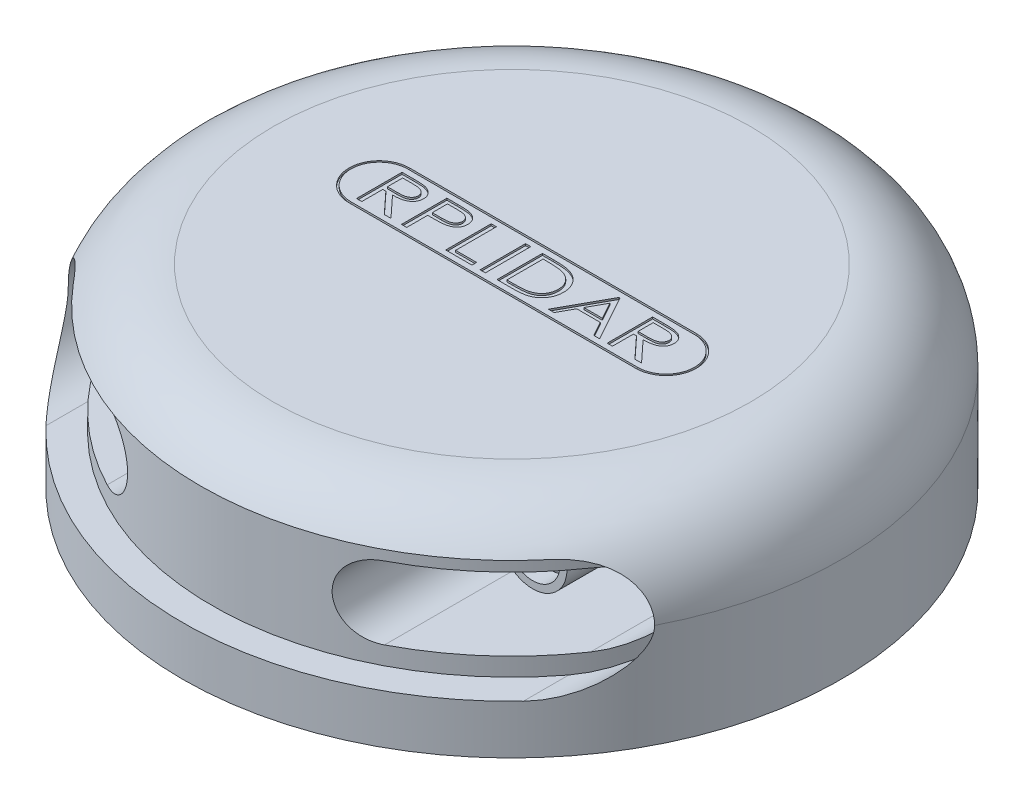
from build123d import *

# Parameters (mm, degrees)
IZIM1_R                     = 36.25
Y_KSEKLIK_EKSTR_ZYON1_DEPTH = 21.4
RADYUS1_R                   = 10
KES_EKSTR_ZYON1_DEPTH       = 41.4
IZIM3_R                     = 33.003248149
Y_KSEKLIK_EKSTR_ZYON2_DEPTH = 12.4
KES_EKSTR_ZYON2_DEPTH       = 44.4
IZIM5_R                     = 3.775
IZIM5_R_2                   = 3
IZIM5_R_3                   = 1.5
Y_KSEKLIK_EKSTR_ZYON4_DEPTH = 16
IZIM6_R                     = 35
KES_EKSTR_ZYON3_DEPTH       = 5
Y_KSEKLIK_EKSTR_ZYON5_START = -3
IZIM8_R                     = 1.5
IZIM8_R_2                   = 3
Y_KSEKLIK_EKSTR_ZYON5_DEPTH = 1
IZIM9_W                     = 0.576923077
IZIM9_H                     = 5
KES_EKSTR_ZYON4_DEPTH       = 0.2
KES_EKSTR_ZYON5_DEPTH       = 0.2


with BuildPart() as part:
    # Çizim1 → Yükseklik-Ekstrüzyon1 (new body)
    with BuildSketch(Plane(origin=(0, 0, 0), x_dir=(1, 0, 0), z_dir=(0, 1, 0))):
        Circle(IZIM1_R)
    extrude(amount=Y_KSEKLIK_EKSTR_ZYON1_DEPTH)

    # Radyus1
    radyus1_edges = [part.edges().sort_by_distance(p)[0] for p in [
        (-36.25, 21.4, 0),
    ]]
    fillet(radyus1_edges, radius=RADYUS1_R)

    # Çizim2 → Kes-Ekstrüzyon1 (cut)
    with BuildSketch(Plane.XY):
        with BuildLine():
            Line((-26.25, 17.4), (26.25, 17.4))
            ThreePointArc((26.25, 17.4), (32.25, 11.4), (26.25, 5.4))
            Line((26.25, 5.4), (-26.25, 5.4))
            ThreePointArc((-26.25, 5.4), (-32.25, 11.4), (-26.25, 17.4))
        make_face()
    extrude(amount=KES_EKSTR_ZYON1_DEPTH, mode=Mode.SUBTRACT)

    # Çizim3 → Yükseklik-Ekstrüzyon2 (add)
    with BuildSketch(Plane(origin=(0, 5.4, 0), x_dir=(1, 0, 0), z_dir=(0, 1, 0))):
        Circle(IZIM3_R)
    extrude(amount=Y_KSEKLIK_EKSTR_ZYON2_DEPTH)

    # Çizim4 → Kes-Ekstrüzyon2 (cut)
    with BuildSketch(Plane.XY):
        with BuildLine():
            Line((-27.25, 15.4), (-15.25, 15.4))
            ThreePointArc((-15.25, 15.4), (-11.25, 11.4), (-15.25, 7.4))
            Line((-15.25, 7.4), (-27.25, 7.4))
            ThreePointArc((-27.25, 7.4), (-31.25, 11.4), (-27.25, 15.4))
        make_face()
        with BuildLine():
            Line((27.25, 15.4), (15.25, 15.4))
            ThreePointArc((15.25, 15.4), (11.25, 11.4), (15.25, 7.4))
            Line((15.25, 7.4), (27.25, 7.4))
            ThreePointArc((27.25, 7.4), (31.25, 11.4), (27.25, 15.4))
        make_face()
    extrude(amount=KES_EKSTR_ZYON2_DEPTH, mode=Mode.SUBTRACT)

    # Çizim5 → Yükseklik-Ekstrüzyon4 (add)
    # profile 1 of 2: a face of its own
    with BuildSketch(Plane.XY):
        with Locations((18.281419494, 11.4)):
            Circle(IZIM5_R)
        with Locations((18.281419494, 11.4)):
            Circle(IZIM5_R_2, mode=Mode.SUBTRACT)
    # profile 2 of 2: a face of its own
    with BuildSketch(Plane.XY):
        with Locations((-26.25, 11.4)):
            Circle(IZIM5_R_2)
        with Locations((-26.25, 11.4)):
            Circle(IZIM5_R_3, mode=Mode.SUBTRACT)
    extrude(amount=Y_KSEKLIK_EKSTR_ZYON4_DEPTH)

    # Çizim6 → Kes-Ekstrüzyon3 (cut)
    with BuildSketch(Plane.XZ):
        Circle(IZIM6_R)
    extrude(amount=-KES_EKSTR_ZYON3_DEPTH, mode=Mode.SUBTRACT)

    # Çizim8 → Yükseklik-Ekstrüzyon5 (add)
    with BuildSketch(Plane.XY.offset(16).offset(Y_KSEKLIK_EKSTR_ZYON5_START)):
        with Locations((-26.25, 11.4)):
            Circle(IZIM8_R)
        with Locations((18.281419494, 11.4)):
            Circle(IZIM8_R_2)
    extrude(amount=Y_KSEKLIK_EKSTR_ZYON5_DEPTH)

    # Çizim9 → Kes-Ekstrüzyon4 (cut)
    # profile 1 of 7: a face of its own
    with BuildSketch(Plane(origin=(0, 21.4, 0), x_dir=(1, 0, 0), z_dir=(0, 1, 0))):
        with BuildLine():
            Line((-14.811265296, 2.721015451), (-13.627371066, 2.721015451))
            add(Edge.make_bspline(
                [(-13.627371066, 2.721015451), (-13.548244875, 2.720793192), (-13.396329701, 2.720366473), (-13.178606522, 2.717986165), (-12.98065628, 2.71115411), (-12.802931058, 2.705348264), (-12.645070101, 2.694505553), (-12.507339404, 2.684541481), (-12.389357514, 2.670789975), (-12.317901466, 2.658518426), (-12.28522363, 2.652906477)],
                knots=[0, 0, 0, 0, 1.411630423, 2.710203546, 3.884117758, 4.945139696, 5.88215703, 6.706718827, 7.408564682, 8, 8, 8, 8], degree=3))
            add(Edge.make_bspline(
                [(-12.28522363, 2.652906477), (-12.241996213, 2.643872149), (-12.156775558, 2.626061432), (-12.033721455, 2.58862483), (-11.916749262, 2.544151294), (-11.805359797, 2.493741591), (-11.700921588, 2.434021444), (-11.602452081, 2.367805983), (-11.509613042, 2.29454005), (-11.424454449, 2.213570862), (-11.345348993, 2.128176641), (-11.278753025, 2.035341371), (-11.220672698, 1.938996717), (-11.174658622, 1.836946947), (-11.138537841, 1.730578976), (-11.112429197, 1.61925413), (-11.095858609, 1.503233296), (-11.09417105, 1.423996485), (-11.093316579, 1.383876028)],
                knots=[0, 0, 0, 0, 1.11641643, 2.200958269, 3.248516537, 4.279957034, 5.289565817, 6.287204707, 7.27885839, 8.276390078, 9.256727559, 10.217710867, 11.160418021, 12.097511966, 13.042749274, 13.99714418, 14.985881811, 16, 16, 16, 16], degree=3))
            add(Edge.make_bspline(
                [(-11.093316579, 1.383876028), (-11.094253954, 1.350137311), (-11.096104869, 1.283517801), (-11.105764691, 1.184938783), (-11.124030569, 1.089893071), (-11.149031153, 0.997619642), (-11.182319144, 0.909146956), (-11.221524408, 0.822778024), (-11.268558565, 0.740078552), (-11.322707917, 0.660565209), (-11.384212868, 0.585994143), (-11.450083531, 0.513978726), (-11.523642305, 0.448211646), (-11.603000324, 0.386459268), (-11.689506833, 0.331172266), (-11.780867316, 0.27819848), (-11.879220625, 0.231612026), (-11.984085156, 0.189009526), (-12.097345013, 0.15219902), (-12.219458111, 0.118639919), (-12.352204202, 0.09256061), (-12.494755415, 0.069109005), (-12.647858216, 0.051490036), (-12.811222324, 0.038627473), (-12.984595694, 0.030532923), (-13.103523951, 0.029327249), (-13.164630681, 0.028707759)],
                knots=[0, 0, 0, 0, 0.870437867, 1.718741786, 2.551384448, 3.36406043, 4.181467661, 4.986810527, 5.808199835, 6.632248171, 7.464757229, 8.299534648, 9.147007689, 10.006514551, 10.890268779, 11.792828836, 12.72878645, 13.694651385, 14.710400546, 15.798752409, 16.958998952, 18.197760763, 19.524398659, 20.932521486, 22.423893651, 24, 24, 24, 24], degree=3))
            Line((-13.164630681, 0.028707759), (-11.029214014, -2.278984549))
            Line((-11.029214014, -2.278984549), (-11.760383886, -2.278984549))
            Line((-11.760383886, -2.278984549), (-13.895800553, 0.028707759))
            Line((-13.895800553, 0.028707759), (-14.23434222, 0.028707759))
            Line((-14.23434222, 0.028707759), (-14.23434222, -2.278984549))
            Line((-14.23434222, -2.278984549), (-14.811265296, -2.278984549))
            Line((-14.811265296, -2.278984549), (-14.811265296, 2.721015451))
        make_face()
        with BuildLine():
            Line((-14.23434222, 2.208194939), (-14.23434222, 0.541528272))
            Line((-14.23434222, 0.541528272), (-13.18766754, 0.534517054))
            add(Edge.make_bspline(
                [(-13.18766754, 0.534517054), (-13.138582028, 0.534493598), (-13.043720757, 0.534448269), (-12.906502217, 0.540178745), (-12.779219242, 0.546624385), (-12.661954234, 0.55656408), (-12.554368116, 0.569522205), (-12.456697785, 0.585113687), (-12.368746987, 0.604171374), (-12.266340722, 0.632784269), (-12.151725427, 0.677602554), (-12.028064547, 0.745040332), (-11.921230397, 0.827527788), (-11.83125886, 0.923244124), (-11.760411168, 1.029154245), (-11.708128362, 1.142178355), (-11.675668274, 1.261552905), (-11.672056072, 1.343613151), (-11.670239655, 1.384877631)],
                knots=[0, 0, 0, 0, 1.205111977, 2.328965291, 3.371672642, 4.334318186, 5.217938529, 6.031964904, 6.761988022, 7.426368084, 8.641199984, 9.775054944, 10.873689325, 11.940859355, 12.986752222, 13.988165942, 14.988337359, 16, 16, 16, 16], degree=3))
            add(Edge.make_bspline(
                [(-11.670239655, 1.384877631), (-11.672061171, 1.425144916), (-11.675684373, 1.505241102), (-11.708222568, 1.622094703), (-11.761218658, 1.732611018), (-11.834010449, 1.835456758), (-11.922208389, 1.92921002), (-12.025971677, 2.009043138), (-12.142215312, 2.074614719), (-12.250002005, 2.116675962), (-12.346166948, 2.142423118), (-12.429966093, 2.160738445), (-12.524988755, 2.175339931), (-12.631304277, 2.186907307), (-12.748494257, 2.197137586), (-12.877102634, 2.2038767), (-13.016700672, 2.207891247), (-13.113545998, 2.20809142), (-13.163629079, 2.208194939)],
                knots=[0, 0, 0, 0, 1.007089001, 2.003213978, 3.013250479, 4.064283037, 5.146917847, 6.225928548, 7.33072321, 8.480016439, 9.113044939, 9.823344944, 10.627712821, 11.519897955, 12.501985578, 13.574102818, 14.745459281, 16, 16, 16, 16], degree=3))
            Line((-13.163629079, 2.208194939), (-14.23434222, 2.208194939))
        make_face(mode=Mode.SUBTRACT)
    # profile 2 of 7: a face of its own
    with BuildSketch(Plane(origin=(0, 21.4, 0), x_dir=(1, 0, 0), z_dir=(0, 1, 0))):
        with BuildLine():
            Line((-9.875367861, 2.721015451), (-8.710504079, 2.721015451))
            add(Edge.make_bspline(
                [(-8.710504079, 2.721015451), (-8.630373341, 2.720944651), (-8.477111744, 2.720809235), (-8.257084981, 2.71646929), (-8.057404582, 2.710767878), (-7.878103358, 2.702738282), (-7.719387761, 2.693416449), (-7.58118934, 2.680043295), (-7.462638198, 2.666340363), (-7.390996871, 2.652296755), (-7.358340617, 2.645895259)],
                knots=[0, 0, 0, 0, 1.418218073, 2.712546675, 3.894916518, 4.953717513, 5.889237769, 6.708316399, 7.411212084, 8, 8, 8, 8], degree=3))
            add(Edge.make_bspline(
                [(-7.358340617, 2.645895259), (-7.317467191, 2.63642007), (-7.236671409, 2.617690168), (-7.119783408, 2.580660765), (-7.008739277, 2.536245678), (-6.903326918, 2.485000114), (-6.803104977, 2.427412641), (-6.709446988, 2.361436243), (-6.621028906, 2.289515411), (-6.539189492, 2.210256199), (-6.463834725, 2.126181798), (-6.399267635, 2.034792119), (-6.344417234, 1.938827962), (-6.298035303, 1.837655211), (-6.265146659, 1.730271094), (-6.239461276, 1.618239024), (-6.224319993, 1.500809334), (-6.222465144, 1.420644225), (-6.221521707, 1.379869618)],
                knots=[0, 0, 0, 0, 1.086341783, 2.147405818, 3.171829542, 4.181180362, 5.180780209, 6.161883427, 7.145042111, 8.129606692, 9.109794985, 10.064714252, 11.021393595, 11.969594772, 12.940393889, 13.924236774, 14.944198669, 16, 16, 16, 16], degree=3))
            add(Edge.make_bspline(
                [(-6.221521707, 1.379869618), (-6.222555538, 1.33877025), (-6.224578967, 1.258329966), (-6.23834793, 1.140147652), (-6.263672674, 1.027954997), (-6.298011871, 0.921112212), (-6.340494488, 0.819051891), (-6.395686701, 0.723873777), (-6.45849134, 0.632979138), (-6.532189425, 0.549188709), (-6.613551698, 0.470727733), (-6.702713253, 0.398693494), (-6.799247152, 0.333432876), (-6.902784351, 0.275200237), (-7.013805822, 0.224088511), (-7.131866056, 0.179073261), (-7.25777106, 0.14082902), (-7.34485006, 0.1209878), (-7.389390296, 0.110839169)],
                knots=[0, 0, 0, 0, 1.045861245, 2.046974867, 3.021934933, 3.967695345, 4.900313686, 5.828704379, 6.76205769, 7.707550943, 8.662917084, 9.635505162, 10.620482456, 11.624763484, 12.654874111, 13.727818363, 14.837796611, 16, 16, 16, 16], degree=3))
            add(Edge.make_bspline(
                [(-7.389390296, 0.110839169), (-7.426065523, 0.104178914), (-7.506467019, 0.089577929), (-7.638854405, 0.073203927), (-7.792859861, 0.059439127), (-7.968572354, 0.048892306), (-8.165578264, 0.040022689), (-8.384271358, 0.03291367), (-8.624685576, 0.029015419), (-8.792300248, 0.028813261), (-8.879774912, 0.028707759)],
                knots=[0, 0, 0, 0, 0.59852503, 1.312120248, 2.141233431, 3.081389991, 4.138754772, 5.308216838, 6.595213503, 8, 8, 8, 8], degree=3))
            Line((-8.879774912, 0.028707759), (-9.298444784, 0.028707759))
            Line((-9.298444784, 0.028707759), (-9.298444784, -2.278984549))
            Line((-9.298444784, -2.278984549), (-9.875367861, -2.278984549))
            Line((-9.875367861, -2.278984549), (-9.875367861, 2.721015451))
        make_face()
        with BuildLine():
            Line((-9.298444784, 2.208194939), (-9.298444784, 0.541528272))
            Line((-9.298444784, 0.541528272), (-8.294839014, 0.530510644))
            add(Edge.make_bspline(
                [(-8.294839014, 0.530510644), (-8.245753842, 0.530490802), (-8.150893228, 0.530452456), (-8.014003258, 0.536120633), (-7.887068356, 0.542708672), (-7.770432682, 0.552369886), (-7.663986092, 0.565852997), (-7.567729817, 0.579684345), (-7.482103629, 0.599529064), (-7.38228731, 0.626032292), (-7.271042541, 0.671364544), (-7.15018903, 0.737642454), (-7.046293112, 0.821251878), (-6.957257664, 0.916157611), (-6.887843897, 1.022478631), (-6.834970449, 1.134965325), (-6.804201874, 1.254717469), (-6.800372415, 1.336632772), (-6.798444784, 1.377866413)],
                knots=[0, 0, 0, 0, 1.216884587, 2.351716704, 3.39634486, 4.368394386, 5.252429777, 6.056753736, 6.777742383, 7.430440621, 8.615602712, 9.746078915, 10.835909208, 11.907861826, 12.959387667, 13.97058409, 14.978454535, 16, 16, 16, 16], degree=3))
            add(Edge.make_bspline(
                [(-6.798444784, 1.377866413), (-6.800384708, 1.418104674), (-6.804254901, 1.498380894), (-6.835209414, 1.616044246), (-6.887762241, 1.7273631), (-6.957665091, 1.832272653), (-7.044323664, 1.927108069), (-7.145903659, 2.007591951), (-7.259210215, 2.075112938), (-7.365266435, 2.116342009), (-7.459613466, 2.142639331), (-7.541517651, 2.160498428), (-7.633815707, 2.175332282), (-7.736467129, 2.186923735), (-7.849650023, 2.197153511), (-7.973589733, 2.203833335), (-8.10817862, 2.207912639), (-8.201352831, 2.20809841), (-8.249766899, 2.208194939)],
                knots=[0, 0, 0, 0, 1.024572037, 2.044043851, 3.075692791, 4.149430532, 5.245489805, 6.335123243, 7.441242237, 8.594652972, 9.222274541, 9.936592297, 10.729720506, 11.603583922, 12.568814115, 13.625561263, 14.766222551, 16, 16, 16, 16], degree=3))
            Line((-8.249766899, 2.208194939), (-9.298444784, 2.208194939))
        make_face(mode=Mode.SUBTRACT)
    # profile 3 of 7: a face of its own
    with BuildSketch(Plane(origin=(0, 21.4, 0), x_dir=(1, 0, 0), z_dir=(0, 1, 0))):
        Polygon((-5.003572989, 2.721015451), (-4.426649912, 2.721015451), (-4.426649912, -1.766164036), (-2.118957604, -1.766164036), (-2.118957604, -2.278984549), (-5.003572989, -2.278984549), align=None)
    # profile 4 of 7: a face of its own
    with BuildSketch(Plane(origin=(0, 21.4, 0), x_dir=(1, 0, 0), z_dir=(0, 1, 0))):
        with Locations((-0.933060169, 0.221015451)):
            Rectangle(IZIM9_W, IZIM9_H)
    # profile 5 of 7: a face of its own
    with BuildSketch(Plane(origin=(0, 21.4, 0), x_dir=(1, 0, 0), z_dir=(0, 1, 0))):
        with BuildLine():
            Line((0.637452652, -2.278984549), (0.637452652, 2.721015451))
            Line((0.637452652, 2.721015451), (1.836370921, 2.721015451))
            add(Edge.make_bspline(
                [(1.836370921, 2.721015451), (1.940876345, 2.720385326), (2.142574008, 2.71916917), (2.433791334, 2.711417467), (2.702677108, 2.697772828), (2.949134513, 2.677650709), (3.173764741, 2.653365656), (3.376299007, 2.622480678), (3.55677558, 2.586624198), (3.668125665, 2.555387321), (3.720385345, 2.54072699)],
                knots=[0, 0, 0, 0, 1.3211948, 2.549933714, 3.682670825, 4.72443222, 5.675778669, 6.538377397, 7.314020028, 8, 8, 8, 8], degree=3))
            add(Edge.make_bspline(
                [(3.720385345, 2.54072699), (3.78885106, 2.518690038), (3.923860706, 2.475234695), (4.117410141, 2.393701941), (4.299204236, 2.300062234), (4.470798611, 2.196092887), (4.629410964, 2.078397957), (4.778390443, 1.951125329), (4.913262875, 1.809885192), (5.037791693, 1.658991543), (5.148542887, 1.498054522), (5.245546558, 1.329083951), (5.326280122, 1.152059169), (5.394413268, 0.968294594), (5.444930292, 0.775878733), (5.481642154, 0.576344097), (5.505906331, 0.369514002), (5.508123535, 0.229097311), (5.509247524, 0.15791449)],
                knots=[0, 0, 0, 0, 1.07436122, 2.118565874, 3.133765883, 4.127984174, 5.11282082, 6.081965103, 7.052225859, 8.026990791, 9.002585186, 9.967895436, 10.934455346, 11.906676447, 12.892927292, 13.902719417, 14.936804816, 16, 16, 16, 16], degree=3))
            add(Edge.make_bspline(
                [(5.509247524, 0.15791449), (5.50800468, 0.096116611), (5.505554524, -0.025712383), (5.488794303, -0.205603063), (5.458167425, -0.379469984), (5.417247141, -0.547832141), (5.365414002, -0.711283512), (5.299748207, -0.868246998), (5.223846202, -1.020327705), (5.135243772, -1.164883919), (5.03887547, -1.302648745), (4.933836907, -1.431592711), (4.822507081, -1.551539287), (4.702978714, -1.66121317), (4.578158707, -1.762801207), (4.445079454, -1.854367348), (4.304818189, -1.936036893), (4.157101916, -2.010455251), (3.998149031, -2.07508686), (3.825271365, -2.129897364), (3.637389717, -2.17546385), (3.434426578, -2.213334526), (3.21650904, -2.243263436), (2.983182496, -2.263630676), (2.735302342, -2.277131772), (2.564888862, -2.27835601), (2.477396563, -2.278984549)],
                knots=[0, 0, 0, 0, 1.007638568, 1.986469346, 2.942307766, 3.883713129, 4.809932898, 5.734968058, 6.655233433, 7.578585121, 8.496851739, 9.394671617, 10.288256471, 11.162750193, 12.037599673, 12.910397323, 13.793641343, 14.68225427, 15.605220733, 16.588265974, 17.636610196, 18.755552882, 19.95349296, 21.221625563, 22.573549637, 24, 24, 24, 24], degree=3))
            Line((2.477396563, -2.278984549), (0.637452652, -2.278984549))
        make_face()
        with BuildLine():
            Line((1.214375729, -1.766164036), (1.880441434, -1.766164036))
            add(Edge.make_bspline(
                [(1.880441434, -1.766164036), (1.976264756, -1.76581211), (2.160252799, -1.765136387), (2.424719851, -1.759143175), (2.666163419, -1.74937351), (2.88493929, -1.735682409), (3.080638279, -1.717678439), (3.253852185, -1.697337515), (3.40418184, -1.672322615), (3.495804936, -1.649496109), (3.538093678, -1.63896051)],
                knots=[0, 0, 0, 0, 1.380201592, 2.650091708, 3.810045458, 4.860555721, 5.807075929, 6.640357142, 7.372455316, 8, 8, 8, 8], degree=3))
            add(Edge.make_bspline(
                [(3.538093678, -1.63896051), (3.591068985, -1.622949055), (3.695155304, -1.591489616), (3.845436289, -1.533211405), (3.986347272, -1.464839225), (4.119648942, -1.388963794), (4.24309805, -1.302459617), (4.35738543, -1.206669615), (4.464582495, -1.103492318), (4.561401135, -0.990171863), (4.648381174, -0.869138705), (4.724912124, -0.741725036), (4.789533611, -0.607702134), (4.841418739, -0.466661817), (4.88267694, -0.319349422), (4.911527346, -0.165528216), (4.928781455, -0.005408543), (4.931128566, 0.103450892), (4.932324447, 0.158916092)],
                knots=[0, 0, 0, 0, 1.078749559, 2.11953602, 3.138517028, 4.12999422, 5.106941517, 6.072897317, 7.034985234, 8.004378337, 8.974470542, 9.9378788, 10.898644562, 11.870787474, 12.864185929, 13.877851293, 14.918739528, 16, 16, 16, 16], degree=3))
            add(Edge.make_bspline(
                [(4.932324447, 0.158916092), (4.93128137, 0.217395313), (4.929231147, 0.332339299), (4.909767639, 0.501207292), (4.877615175, 0.663261693), (4.833326214, 0.818975158), (4.777845936, 0.969098459), (4.706678088, 1.111588639), (4.624641797, 1.248160436), (4.530358361, 1.377760027), (4.42424139, 1.498215033), (4.308720541, 1.610672594), (4.181675006, 1.711203683), (4.046589779, 1.804372601), (3.900062214, 1.885051669), (3.744855479, 1.95772211), (3.578720544, 2.018752879), (3.463539177, 2.051363106), (3.404880537, 2.06797058)],
                knots=[0, 0, 0, 0, 1.058669847, 2.080871278, 3.073316351, 4.047471421, 5.009847859, 5.967025571, 6.92717743, 7.89220902, 8.864786813, 9.831124328, 10.807453351, 11.795172645, 12.799353072, 13.832651409, 14.896230148, 16, 16, 16, 16], degree=3))
            add(Edge.make_bspline(
                [(3.404880537, 2.06797058), (3.356258255, 2.079589589), (3.252310932, 2.104429332), (3.083799856, 2.13090293), (2.893764558, 2.155039271), (2.681981837, 2.174829186), (2.447814957, 2.189382542), (2.192018698, 2.200109284), (1.914204453, 2.207445445), (1.721859468, 2.20793885), (1.622027973, 2.208194939)],
                knots=[0, 0, 0, 0, 0.669246088, 1.430750214, 2.28257198, 3.234651627, 4.278572046, 5.424227125, 6.663114321, 8, 8, 8, 8], degree=3))
            Line((1.622027973, 2.208194939), (1.214375729, 2.208194939))
            Line((1.214375729, 2.208194939), (1.214375729, -1.766164036))
        make_face(mode=Mode.SUBTRACT)
    # profile 6 of 7: a face of its own
    with BuildSketch(Plane(origin=(0, 21.4, 0), x_dir=(1, 0, 0), z_dir=(0, 1, 0))):
        Polygon((9.163093678, 2.721015451), (11.919503934, -2.278984549), (11.283486306, -2.278984549), (10.400072845, -0.676420446), (7.798910986, -0.676420446), (6.914495921, -2.278984549), (6.278478293, -2.278984549), (9.03488855, 2.721015451), align=None)
        Polygon((9.098991114, 1.682353592), (8.080361306, -0.163599933), (10.116619319, -0.163599933), align=None, mode=Mode.SUBTRACT)
    # profile 7 of 7: a face of its own
    with BuildSketch(Plane(origin=(0, 21.4, 0), x_dir=(1, 0, 0), z_dir=(0, 1, 0))):
        with BuildLine():
            Line((12.752837268, 2.721015451), (13.936731498, 2.721015451))
            add(Edge.make_bspline(
                [(13.936731498, 2.721015451), (14.015857689, 2.720793192), (14.167772863, 2.720366473), (14.385496042, 2.717986165), (14.583446284, 2.71115411), (14.761171507, 2.705348264), (14.919032463, 2.694505553), (15.05676316, 2.684541481), (15.17474505, 2.670789975), (15.246201098, 2.658518426), (15.278878934, 2.652906477)],
                knots=[0, 0, 0, 0, 1.411630423, 2.710203546, 3.884117758, 4.945139696, 5.88215703, 6.706718827, 7.408564682, 8, 8, 8, 8], degree=3))
            add(Edge.make_bspline(
                [(15.278878934, 2.652906477), (15.322106351, 2.643872149), (15.407327006, 2.626061432), (15.530381109, 2.58862483), (15.647353302, 2.544151294), (15.758742767, 2.493741591), (15.863180976, 2.434021444), (15.961650484, 2.367805983), (16.054489522, 2.29454005), (16.139648115, 2.213570862), (16.218753571, 2.128176641), (16.285349539, 2.035341371), (16.343429866, 1.938996717), (16.389443942, 1.836946947), (16.425564723, 1.730578976), (16.451673367, 1.61925413), (16.468243956, 1.503233296), (16.469931514, 1.423996485), (16.470785986, 1.383876028)],
                knots=[0, 0, 0, 0, 1.11641643, 2.200958269, 3.248516537, 4.279957034, 5.289565817, 6.287204707, 7.27885839, 8.276390078, 9.256727559, 10.217710867, 11.160418021, 12.097511966, 13.042749274, 13.99714418, 14.985881811, 16, 16, 16, 16], degree=3))
            add(Edge.make_bspline(
                [(16.470785986, 1.383876028), (16.46984861, 1.350137311), (16.467997695, 1.283517801), (16.458337873, 1.184938783), (16.440071995, 1.089893071), (16.415071411, 0.997619642), (16.38178342, 0.909146956), (16.342578156, 0.822778024), (16.295543999, 0.740078552), (16.241394647, 0.660565209), (16.179889696, 0.585994143), (16.114019033, 0.513978726), (16.040460259, 0.448211646), (15.96110224, 0.386459268), (15.874595731, 0.331172266), (15.783235248, 0.27819848), (15.684881939, 0.231612026), (15.580017408, 0.189009526), (15.466757551, 0.15219902), (15.344644453, 0.118639919), (15.211898362, 0.09256061), (15.069347149, 0.069109005), (14.916244349, 0.051490036), (14.75288024, 0.038627473), (14.57950687, 0.030532923), (14.460578613, 0.029327249), (14.399471883, 0.028707759)],
                knots=[0, 0, 0, 0, 0.870437867, 1.718741786, 2.551384448, 3.36406043, 4.181467661, 4.986810527, 5.808199835, 6.632248171, 7.464757229, 8.299534648, 9.147007689, 10.006514551, 10.890268779, 11.792828836, 12.72878645, 13.694651385, 14.710400546, 15.798752409, 16.958998952, 18.197760763, 19.524398659, 20.932521486, 22.423893651, 24, 24, 24, 24], degree=3))
            Line((14.399471883, 0.028707759), (16.53488855, -2.278984549))
            Line((16.53488855, -2.278984549), (15.803718678, -2.278984549))
            Line((15.803718678, -2.278984549), (13.668302011, 0.028707759))
            Line((13.668302011, 0.028707759), (13.329760345, 0.028707759))
            Line((13.329760345, 0.028707759), (13.329760345, -2.278984549))
            Line((13.329760345, -2.278984549), (12.752837268, -2.278984549))
            Line((12.752837268, -2.278984549), (12.752837268, 2.721015451))
        make_face()
        with BuildLine():
            Line((13.329760345, 2.208194939), (13.329760345, 0.541528272))
            Line((13.329760345, 0.541528272), (14.376435024, 0.534517054))
            add(Edge.make_bspline(
                [(14.376435024, 0.534517054), (14.425520536, 0.534493598), (14.520381807, 0.534448269), (14.657600347, 0.540178745), (14.784883322, 0.546624385), (14.90214833, 0.55656408), (15.009734448, 0.569522205), (15.107404779, 0.585113687), (15.195355577, 0.604171374), (15.297761842, 0.632784269), (15.412377137, 0.677602554), (15.536038017, 0.745040332), (15.642872167, 0.827527788), (15.732843704, 0.923244124), (15.803691396, 1.029154245), (15.855974202, 1.142178355), (15.888434291, 1.261552905), (15.892046492, 1.343613151), (15.893862909, 1.384877631)],
                knots=[0, 0, 0, 0, 1.205111977, 2.328965291, 3.371672642, 4.334318186, 5.217938529, 6.031964904, 6.761988022, 7.426368084, 8.641199984, 9.775054944, 10.873689325, 11.940859355, 12.986752222, 13.988165942, 14.988337359, 16, 16, 16, 16], degree=3))
            add(Edge.make_bspline(
                [(15.893862909, 1.384877631), (15.892041393, 1.425144916), (15.888418191, 1.505241102), (15.855879996, 1.622094703), (15.802883906, 1.732611018), (15.730092115, 1.835456758), (15.641894175, 1.92921002), (15.538130887, 2.009043138), (15.421887252, 2.074614719), (15.314100559, 2.116675962), (15.217935616, 2.142423118), (15.134136471, 2.160738445), (15.03911381, 2.175339931), (14.932798287, 2.186907307), (14.815608307, 2.197137586), (14.68699993, 2.2038767), (14.547401893, 2.207891247), (14.450556567, 2.20809142), (14.400473486, 2.208194939)],
                knots=[0, 0, 0, 0, 1.007089001, 2.003213978, 3.013250479, 4.064283037, 5.146917847, 6.225928548, 7.33072321, 8.480016439, 9.113044939, 9.823344944, 10.627712821, 11.519897955, 12.501985578, 13.574102818, 14.745459281, 16, 16, 16, 16], degree=3))
            Line((14.400473486, 2.208194939), (13.329760345, 2.208194939))
        make_face(mode=Mode.SUBTRACT)
    extrude(amount=-KES_EKSTR_ZYON4_DEPTH, mode=Mode.SUBTRACT)

    # Çizim10 → Kes-Ekstrüzyon5 (cut)
    with BuildSketch(Plane(origin=(0, 21.4, 0), x_dir=(1, 0, 0), z_dir=(0, 1, 0))):
        with BuildLine():
            Line((-14.811265296, 3.545310896), (16.728928569, 3.545310896))
            ThreePointArc((16.728928569, 3.545310896), (20.053224013, 0.221015451), (16.728928569, -3.103279993))
            Line((16.728928569, -3.103279993), (-14.811265296, -3.103279993))
            ThreePointArc((-14.811265296, -3.103279993), (-18.135560741, 0.221015451), (-14.811265296, 3.545310896))
        make_face()
        with BuildLine():
            Line((-14.811265296, 3.345310896), (16.728928569, 3.345310896))
            ThreePointArc((16.728928569, 3.345310896), (19.853224013, 0.221015451), (16.728928569, -2.903279993))
            Line((16.728928569, -2.903279993), (-14.811265296, -2.903279993))
            ThreePointArc((-14.811265296, -2.903279993), (-17.935560741, 0.221015451), (-14.811265296, 3.345310896))
        make_face(mode=Mode.SUBTRACT)
    extrude(amount=-KES_EKSTR_ZYON5_DEPTH, mode=Mode.SUBTRACT)


solid = part.part
